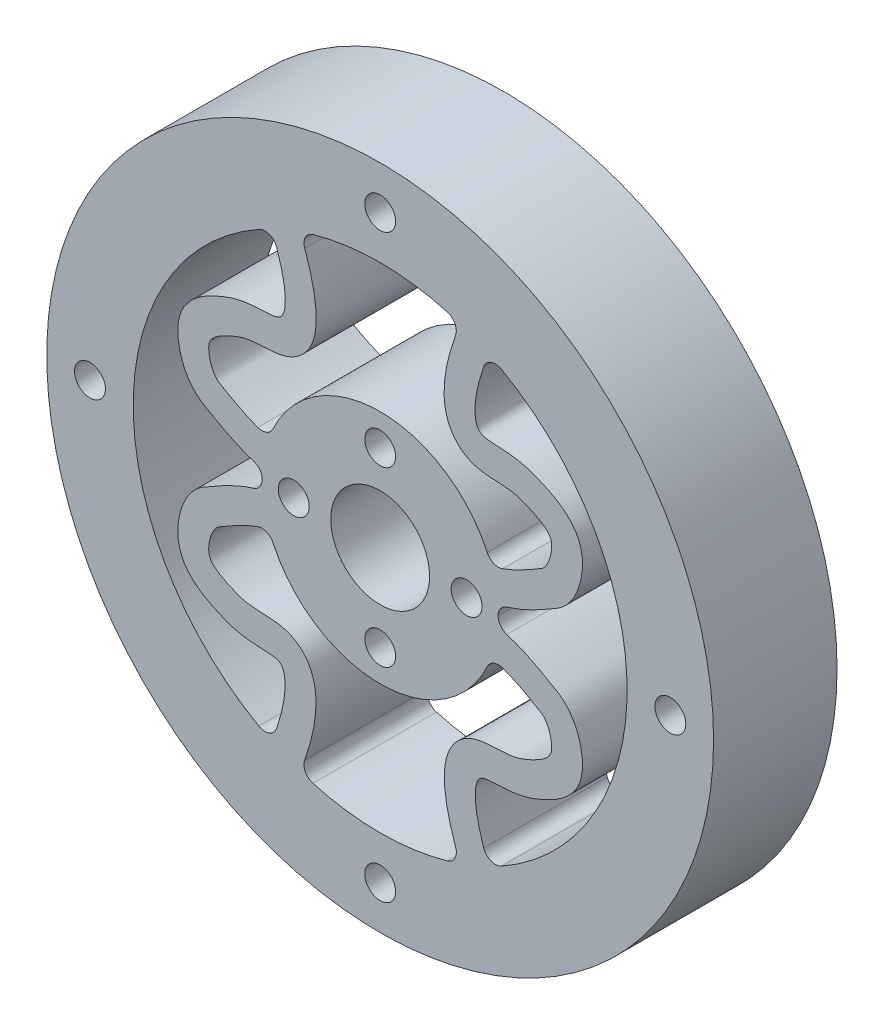
from build123d import *

# Parameters (mm, degrees)
BOSS_EXTRUDE1_OUTLINE_R   = 27
BOSS_EXTRUDE1_OUTLINE_R_2 = 1.25
BOSS_EXTRUDE1_OUTLINE_R_3 = 4
BOSS_EXTRUDE1_DEPTH       = 10
FILLET1_R                 = 1
SCALE1_SCALE              = 0.69


# Read off the part's stored shape, not the designer's step: Boss-Extrude1
with BuildPart() as part:
    # Boss-Extrude1 outline → Boss-Extrude1 (new body)
    with BuildSketch(Plane.XY):
        Circle(BOSS_EXTRUDE1_OUTLINE_R)
        with BuildLine():
            add(Edge.make_bspline(
                [(6.483801843, -18.919839155), (6.480612205, -18.912032776), (6.441503957, -18.816167051), (6.347612357, -18.58122213), (6.119029267, -17.980388927), (5.789810817, -17.013794353), (5.429669957, -15.668496809), (5.191806498, -14.230135337), (5.175407974, -12.761834066), (5.524401823, -11.283291588), (6.409718684, -10.166991751), (7.454125678, -9.625091073), (8.350033292, -9.42542645), (9.170309196, -9.376479516), (9.947678619, -9.350570154), (10.675240534, -9.288463207), (11.237211138, -9.169079776), (11.932036453, -8.89638821), (12.637697815, -8.576891164), (13.211834821, -8.233451201), (13.613150576, -7.882315625), (13.813065964, -7.569945647), (13.896838471, -7.281813359), (13.879539964, -6.641593544), (13.73039878, -6.059941379), (13.55175681, -5.653270156), (13.396702845, -5.396835282), (13.265283039, -5.238744867), (13.160626685, -5.14359219), (13.101918554, -5.098485448), (12.979648753, -5.022079201), (12.577995362, -4.7934595), (11.724742054, -4.291783433), (10.601060528, -3.730602471), (9.652508015, -3.377233049), (9.21951845, -3.260097231), (8.993066806, -3.214723866)],
                knots=[0.007762367, 0.007762367, 0.007762367, 0.007762367, 0.009702959, 0.03125, 0.0625, 0.125, 0.1875, 0.25, 0.3125, 0.375, 0.4375, 0.46875, 0.5, 0.53125, 0.5625, 0.59375, 0.625, 0.65625, 0.6875, 0.71875, 0.75, 0.78125, 0.8125, 0.84375, 0.875, 0.890625, 0.90625, 0.921875, 0.9296875, 0.9375, 0.9453125, 0.953125, 0.96875, 0.984375, 0.9921875, 1, 1, 1, 1], degree=3))
            ThreePointArc((6.483801843, -18.919839155), (0, -20), (-6.483801843, -18.919839155))
            add(Edge.make_bspline(
                [(-6.483801843, -18.919839155), (-6.480612205, -18.912032776), (-6.441503957, -18.816167051), (-6.347612357, -18.58122213), (-6.119029267, -17.980388927), (-5.789810817, -17.013794353), (-5.429669957, -15.668496809), (-5.191806498, -14.230135337), (-5.175407974, -12.761834066), (-5.524401823, -11.283291588), (-6.409718684, -10.166991751), (-7.454125678, -9.625091073), (-8.350033292, -9.42542645), (-9.170309196, -9.376479516), (-9.947678619, -9.350570154), (-10.675240534, -9.288463207), (-11.237211138, -9.169079776), (-11.932036453, -8.89638821), (-12.637697815, -8.576891164), (-13.211834821, -8.233451201), (-13.613150576, -7.882315625), (-13.813065964, -7.569945647), (-13.896838471, -7.281813359), (-13.879539964, -6.641593544), (-13.73039878, -6.059941379), (-13.55175681, -5.653270156), (-13.396702845, -5.396835282), (-13.265283039, -5.238744867), (-13.160626685, -5.14359219), (-13.101918554, -5.098485448), (-12.979648753, -5.022079201), (-12.577995362, -4.7934595), (-11.724742054, -4.291783433), (-10.601060528, -3.730602471), (-9.652508015, -3.377233049), (-9.21951845, -3.260097231), (-8.993066806, -3.214723866)],
                knots=[0.007762367, 0.007762367, 0.007762367, 0.007762367, 0.009702959, 0.03125, 0.0625, 0.125, 0.1875, 0.25, 0.3125, 0.375, 0.4375, 0.46875, 0.5, 0.53125, 0.5625, 0.59375, 0.625, 0.65625, 0.6875, 0.71875, 0.75, 0.78125, 0.8125, 0.84375, 0.875, 0.890625, 0.90625, 0.921875, 0.9296875, 0.9375, 0.9453125, 0.953125, 0.96875, 0.984375, 0.9921875, 1, 1, 1, 1], degree=3))
            ThreePointArc((-8.993066806, -3.214723866), (0, -9.550376962), (8.993066806, -3.214723866))
        make_face(mode=Mode.SUBTRACT)
        with Locations((0, -23.5)):
            Circle(BOSS_EXTRUDE1_OUTLINE_R_2, mode=Mode.SUBTRACT)
        with Locations((0, -7)):
            Circle(BOSS_EXTRUDE1_OUTLINE_R_2, mode=Mode.SUBTRACT)
        with Locations((-23.5, 0)):
            Circle(BOSS_EXTRUDE1_OUTLINE_R_2, mode=Mode.SUBTRACT)
        with BuildLine():
            add(Edge.make_bspline(
                [(-8.793765965, -17.963008661), (-8.790561612, -17.955152681), (-8.757299555, -17.873459033), (-8.675456351, -17.668379774), (-8.473919568, -17.138762569), (-8.182262794, -16.281745106), (-7.874017475, -15.126473634), (-7.688580164, -13.981174059), (-7.68708969, -12.988779781), (-7.882450811, -12.340385911), (-8.105574911, -12.101711107), (-8.427286637, -11.936185887), (-9.255887466, -11.873584818), (-10.061993387, -11.846676872), (-10.980530297, -11.780784628), (-12.037855007, -11.548544014), (-12.901369588, -11.200056501), (-14.054290483, -10.681134366), (-15.231238441, -9.924658048), (-16.128927134, -8.661627788), (-16.433708137, -7.419671476), (-16.361750971, -6.266622794), (-16.068776901, -5.081044273), (-15.596575411, -4.134652828), (-15.106286502, -3.535992931), (-14.774613082, -3.227707308), (-14.488277389, -3.0127142), (-14.214236794, -2.847608081), (-13.840221024, -2.635292087), (-12.932474986, -2.101308455), (-11.383068607, -1.322241381), (-10.154677906, -0.901179774), (-9.522201544, -0.770857912), (-9.519265086, -0.770254719)],
                knots=[0.008782184, 0.008782184, 0.008782184, 0.008782184, 0.01097773, 0.03125, 0.0625, 0.125, 0.1875, 0.25, 0.3125, 0.375, 0.4375, 0.5, 0.53125, 0.5625, 0.59375, 0.625, 0.65625, 0.6875, 0.75, 0.78125, 0.8125, 0.84375, 0.875, 0.90625, 0.921875, 0.9296875, 0.9375, 0.9453125, 0.953125, 0.96875, 0.984375, 0.999644738, 0.99971579, 0.99971579, 0.99971579, 0.99971579], degree=3))
            ThreePointArc((-8.793765965, -17.963008661), (-20, 0), (-8.793765965, 17.963008661))
            add(Edge.make_bspline(
                [(-8.793765965, 17.963008661), (-8.792390185, 17.959667216), (-8.751090896, 17.859289875), (-8.659149113, 17.630898508), (-8.442492857, 17.062585707), (-8.150200233, 16.204626452), (-7.847022713, 15.063271185), (-7.669490667, 13.941546746), (-7.675936835, 12.977642097), (-7.87172167, 12.356105989), (-8.096556435, 12.116445797), (-8.437268015, 11.945555936), (-9.265970028, 11.877370514), (-10.069148732, 11.843745886), (-10.982990761, 11.771223658), (-12.032129114, 11.536768835), (-12.892956915, 11.190784402), (-14.04568893, 10.675396667), (-15.225024196, 9.924481098), (-16.127345354, 8.662487813), (-16.433024316, 7.418347937), (-16.360717665, 6.265882856), (-16.068019021, 5.080296428), (-15.595762735, 4.133827462), (-15.105222866, 3.535092161), (-14.773373049, 3.226801646), (-14.486865721, 3.011813821), (-14.212855625, 2.846812002), (-13.839019105, 2.634637657), (-12.931736587, 2.100862468), (-11.383019871, 1.3220545), (-10.15471139, 0.901122285), (-9.522198334, 0.770856958), (-9.519265086, 0.770254719)],
                knots=[0.003708072, 0.003708072, 0.003708072, 0.003708072, 0.00463509, 0.03125, 0.0625, 0.125, 0.1875, 0.25, 0.3125, 0.375, 0.4375, 0.5, 0.53125, 0.5625, 0.59375, 0.625, 0.65625, 0.6875, 0.75, 0.78125, 0.8125, 0.84375, 0.875, 0.90625, 0.921875, 0.9296875, 0.9375, 0.9453125, 0.953125, 0.96875, 0.984375, 0.999645143, 0.999716115, 0.999716115, 0.999716115, 0.999716115], degree=3))
            ThreePointArc((-9.519265086, 0.770254719), (-9.550376962, 0), (-9.519265086, -0.770254719))
        make_face(mode=Mode.SUBTRACT)
        with Locations((-7, 0)):
            Circle(BOSS_EXTRUDE1_OUTLINE_R_2, mode=Mode.SUBTRACT)
        Circle(BOSS_EXTRUDE1_OUTLINE_R_3, mode=Mode.SUBTRACT)
        with Locations((7, 0)):
            Circle(BOSS_EXTRUDE1_OUTLINE_R_2, mode=Mode.SUBTRACT)
        with Locations((0, 7)):
            Circle(BOSS_EXTRUDE1_OUTLINE_R_2, mode=Mode.SUBTRACT)
        with BuildLine():
            add(Edge.make_bspline(
                [(-6.483801843, 18.919839155), (-6.482428599, 18.916506133), (-6.435464145, 18.802446138), (-6.331751534, 18.544967686), (-6.088032516, 17.905633276), (-5.757506339, 16.936431605), (-5.401217095, 15.600475059), (-5.170938786, 14.177815551), (-5.164642087, 12.726303988), (-5.529593155, 11.262265681), (-6.422218406, 10.16816807), (-7.45697845, 9.636564412), (-8.34365536, 9.435395123), (-9.159513397, 9.380214885), (-9.934554469, 9.347855416), (-10.662113343, 9.280670847), (-11.229957293, 9.157678589), (-11.928251207, 8.884298538), (-12.636049231, 8.566038906), (-13.211909719, 8.224307826), (-13.613520282, 7.875254277), (-13.812127691, 7.566169682), (-13.895424665, 7.281234026), (-13.878139336, 6.639916023), (-13.729050873, 6.058586057), (-13.550532405, 5.652168502), (-13.395576418, 5.39596311), (-13.264221021, 5.238013923), (-13.159545079, 5.142897705), (-13.100787625, 5.097777089), (-12.978253874, 5.021254727), (-12.576385364, 4.792575773), (-11.723550617, 4.29110232), (-10.60055857, 3.730267544), (-9.65244952, 3.377137573), (-9.219480083, 3.260062194), (-8.993066806, 3.214723866)],
                knots=[0.003301299, 0.003301299, 0.003301299, 0.003301299, 0.004126624, 0.03125, 0.0625, 0.125, 0.1875, 0.25, 0.3125, 0.375, 0.4375, 0.46875, 0.5, 0.53125, 0.5625, 0.59375, 0.625, 0.65625, 0.6875, 0.71875, 0.75, 0.78125, 0.8125, 0.84375, 0.875, 0.890625, 0.90625, 0.921875, 0.9296875, 0.9375, 0.9453125, 0.953125, 0.96875, 0.984375, 0.9921875, 1, 1, 1, 1], degree=3))
            ThreePointArc((-6.483801843, 18.919839155), (0, 20), (6.483801843, 18.919839155))
            add(Edge.make_bspline(
                [(6.483801843, 18.919839155), (6.427558814, 18.784051049), (6.324537132, 18.529168098), (6.073882061, 17.871349196), (5.745428657, 16.907087807), (5.392085426, 15.577928796), (5.165001465, 14.161924058), (5.162032487, 12.716063833), (5.531376946, 11.256563451), (6.425565101, 10.168329975), (7.457974124, 9.63919877), (8.342543019, 9.437703347), (9.157376636, 9.381112059), (9.931882007, 9.347282574), (10.659445482, 9.278940922), (11.228646085, 9.155126895), (11.927746574, 8.881616393), (12.636043239, 8.56367028), (13.212306684, 8.222358626), (13.613990776, 7.873804728), (13.812299546, 7.565496628), (13.895496378, 7.281312129), (13.878231204, 6.639848031), (13.729136155, 6.05855138), (13.550624612, 5.652134143), (13.39567622, 5.395932335), (13.264328523, 5.237983984), (13.159663821, 5.142870471), (13.10090948, 5.097749149), (12.978423161, 5.021248624), (12.576606002, 4.792594285), (11.723719853, 4.29112662), (10.600636073, 3.730284389), (9.652465038, 3.377144046), (9.219486979, 3.260065429), (8.993066806, 3.214723866)],
                knots=[2.7542e-05, 2.7542e-05, 2.7542e-05, 2.7542e-05, 0.03125, 0.0625, 0.125, 0.1875, 0.25, 0.3125, 0.375, 0.4375, 0.46875, 0.5, 0.53125, 0.5625, 0.59375, 0.625, 0.65625, 0.6875, 0.71875, 0.75, 0.78125, 0.8125, 0.84375, 0.875, 0.890625, 0.90625, 0.921875, 0.9296875, 0.9375, 0.9453125, 0.953125, 0.96875, 0.984375, 0.9921875, 1, 1, 1, 1], degree=3))
            ThreePointArc((8.993066806, 3.214723866), (0, 9.550376962), (-8.993066806, 3.214723866))
        make_face(mode=Mode.SUBTRACT)
        with BuildLine():
            add(Edge.make_bspline(
                [(8.793765964, 17.963008661), (8.743696315, 17.842124252), (8.652024593, 17.615315229), (8.428556729, 17.028880945), (8.138535996, 16.176583266), (7.838516203, 15.04335892), (7.664046059, 13.930304494), (7.672917525, 12.974810129), (7.868875384, 12.359933936), (8.09461171, 12.119578752), (8.439880369, 11.947457623), (9.268619588, 11.87798157), (10.071117318, 11.842821716), (10.983851503, 11.768791985), (12.03106163, 11.533866993), (12.89126609, 11.188486281), (14.043949333, 10.673948938), (15.223811446, 9.924371515), (16.12718592, 8.662713201), (16.433111818, 7.418171723), (16.360730957, 6.265768417), (16.068051422, 5.080203116), (15.595819703, 4.133782126), (15.105329849, 3.535077718), (14.773513769, 3.226799381), (14.487046012, 3.011821514), (14.213025533, 2.846799467), (13.839137176, 2.634594588), (12.931786752, 2.100819871), (11.38089886, 1.320987455), (10.135468469, 0.896850952), (9.519264913, 0.770256852)],
                knots=[3.1817e-05, 3.1817e-05, 3.1817e-05, 3.1817e-05, 0.03125, 0.0625, 0.125, 0.1875, 0.25, 0.3125, 0.375, 0.4375, 0.5, 0.53125, 0.5625, 0.59375, 0.625, 0.65625, 0.6875, 0.75, 0.78125, 0.8125, 0.84375, 0.875, 0.90625, 0.921875, 0.9296875, 0.9375, 0.9453125, 0.953125, 0.96875, 0.984375, 0.99970761, 0.99970761, 0.99970761, 0.99970761], degree=3))
            ThreePointArc((8.793765964, 17.963008661), (20, 0), (8.793765965, -17.963008661))
            add(Edge.make_bspline(
                [(8.793765965, -17.963008661), (8.790561612, -17.955152681), (8.757299555, -17.873459033), (8.675456351, -17.668379774), (8.473919568, -17.138762569), (8.182262794, -16.281745106), (7.874017475, -15.126473634), (7.688580164, -13.981174059), (7.68708969, -12.988779781), (7.882450811, -12.340385911), (8.105574911, -12.101711107), (8.427286637, -11.936185887), (9.255887466, -11.873584818), (10.061993387, -11.846676872), (10.980530297, -11.780784628), (12.037855007, -11.548544014), (12.901369588, -11.200056501), (14.054290483, -10.681134366), (15.231238441, -9.924658048), (16.128927134, -8.661627788), (16.433708137, -7.419671476), (16.361750971, -6.266622794), (16.068776901, -5.081044273), (15.596575411, -4.134652828), (15.106286502, -3.535992931), (14.774613082, -3.227707308), (14.488277389, -3.0127142), (14.214236794, -2.847608081), (13.840221024, -2.635292087), (12.932474986, -2.101308455), (11.383068607, -1.322241381), (10.154677906, -0.901179774), (9.522201544, -0.770857912), (9.519265086, -0.770254719)],
                knots=[0.008782184, 0.008782184, 0.008782184, 0.008782184, 0.01097773, 0.03125, 0.0625, 0.125, 0.1875, 0.25, 0.3125, 0.375, 0.4375, 0.5, 0.53125, 0.5625, 0.59375, 0.625, 0.65625, 0.6875, 0.75, 0.78125, 0.8125, 0.84375, 0.875, 0.90625, 0.921875, 0.9296875, 0.9375, 0.9453125, 0.953125, 0.96875, 0.984375, 0.999644738, 0.99971579, 0.99971579, 0.99971579, 0.99971579], degree=3))
            ThreePointArc((9.519265086, -0.770254719), (9.550376962, 1.07e-06), (9.519264913, 0.770256852))
        make_face(mode=Mode.SUBTRACT)
        with Locations((23.5, 0)):
            Circle(BOSS_EXTRUDE1_OUTLINE_R_2, mode=Mode.SUBTRACT)
        with Locations((0, 23.5)):
            Circle(BOSS_EXTRUDE1_OUTLINE_R_2, mode=Mode.SUBTRACT)
    extrude(amount=BOSS_EXTRUDE1_DEPTH)

    # Fillet1
    fillet1_edges = [part.edges().sort_by_distance(p)[0] for p in [
        (8.993066806, 3.214723866, 5),
        (-8.993066806, 3.214723866, 5),
        (9.519264913, 0.770256852, 5),
        (9.519265086, -0.770254719, 5),
        (8.993066806, -3.214723866, 5),
        (-8.993066806, -3.214723866, 5),
        (-9.519265086, 0.770254719, 5),
        (-9.519265086, -0.770254719, 5),
        (6.483801843, -18.919839155, 5),
        (-8.793765965, -17.963008661, 5),
        (8.793765965, -17.963008661, 5),
        (6.483801843, 18.919839155, 5),
        (8.793765964, 17.963008661, 5),
        (-6.483801843, -18.919839155, 5),
        (-6.483801843, 18.919839155, 5),
        (-8.793765965, 17.963008661, 5),
    ]]
    fillet(fillet1_edges, radius=FILLET1_R)


with BuildPart() as part_1:
    # Scale1: scaled about (-0.000911226, -0.001006209, 5)
    add(part.part.scale(SCALE1_SCALE).moved(Location((-0.00028248, -0.000311925, 1.55))))


solid = part_1.part
